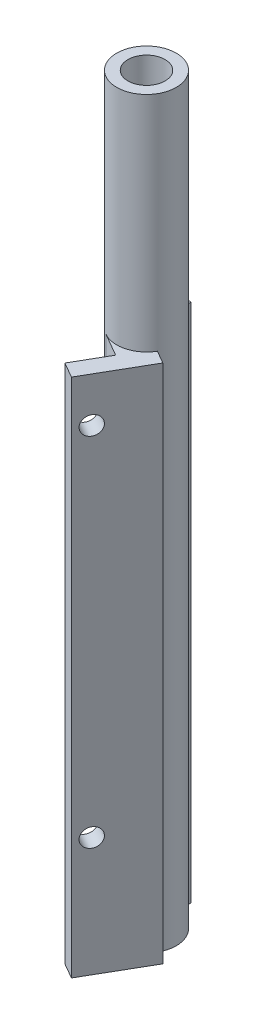
from build123d import *

# Parameters (mm, degrees)
SKETCH1_R           = 5.08
BOSS_EXTRUDE1_DEPTH = 127
SKETCH2_R           = 3.175
CUT_EXTRUDE1_DEPTH  = 128.2030377
BOSS_EXTRUDE2_DEPTH = 88.9
CUT_EXTRUDE2_REACH  = 130.39
SKETCH4_R           = 1.5875
CUT_EXTRUDE6_REACH  = 130.39
SKETCH7_R           = 1.5875
CUT_EXTRUDE7_REACH  = 130.39
SKETCH8_W           = 6.35
SKETCH8_H           = 4.572
SKETCH9_W           = 11.43
SKETCH9_H           = 88.9
CUT_EXTRUDE8_DEPTH  = 2.54
SKETCH10_W          = 11.43
SKETCH10_H          = 88.9
CUT_EXTRUDE9_DEPTH  = 2.54


with BuildPart() as part:
    # Sketch1 → Boss-Extrude1 (new body)
    with BuildSketch(Plane(origin=(0, 0, 0), x_dir=(1, 0, 0), z_dir=(0, 1, 0))):
        Circle(SKETCH1_R)
    extrude(amount=BOSS_EXTRUDE1_DEPTH)

    # Sketch2 → Cut-Extrude1 (cut, through all)
    with BuildSketch(Plane.XZ):
        Circle(SKETCH2_R)
    extrude(amount=-CUT_EXTRUDE1_DEPTH, mode=Mode.SUBTRACT)

    # Sketch3 → Boss-Extrude2 (add)
    with BuildSketch(Plane.XZ):
        with BuildLine():
            Line((-1.315590949, 12.438670365), (-5.715, 9.898670365))
            Line((-5.715, 9.898670365), (-2.54, 4.399409051))
            ThreePointArc((-2.54, 4.399409051), (2.749630657, -1.5875), (-5.08, 0))
            Line((-5.08, 0), (-11.43, 0))
            Line((-11.43, 0), (-11.43, -5.08))
            Line((-11.43, -5.08), (-11.43, -10.16))
            Line((-11.43, -10.16), (0, -10.16))
            Line((0, -10.16), (0, -5.08))
            ThreePointArc((0, -5.08), (4.399409051, -2.54), (4.399409051, 2.54))
            Line((4.399409051, 2.54), (8.798818102, 5.08))
            Line((8.798818102, 5.08), (3.083818102, 14.978670365))
            Line((3.083818102, 14.978670365), (-1.315590949, 12.438670365))
        make_face()
    extrude(amount=-BOSS_EXTRUDE2_DEPTH)

    # Sketch4 → Cut-Extrude2 (cut, up to next)
    with BuildSketch(Plane.XY, mode=Mode.PRIVATE) as cut_extrude2_sk1:
        with Locations((-8.89, 81.28)):
            Circle(SKETCH4_R)
    cut_extrude2_tool1 = extrude(cut_extrude2_sk1.sketch, amount=-CUT_EXTRUDE2_REACH, mode=Mode.PRIVATE) & part.part
    # Sketch4 → Cut-Extrude2 (cut, up to next)
    with BuildSketch(Plane.XY, mode=Mode.PRIVATE) as cut_extrude2_sk2:
        with Locations((-8.89, 20.32)):
            Circle(SKETCH4_R)
    cut_extrude2_tool2 = extrude(cut_extrude2_sk2.sketch, amount=-CUT_EXTRUDE2_REACH, mode=Mode.PRIVATE) & part.part
    add(cut_extrude2_tool1.solids().sort_by_distance((-8.89, 81.28, 0))[0], mode=Mode.SUBTRACT)
    add(cut_extrude2_tool2.solids().sort_by_distance((-8.89, 20.32, 0))[0], mode=Mode.SUBTRACT)

    # Sketch7 → Cut-Extrude6 (cut, up to next)
    with BuildSketch(Plane(origin=(0, 0, 0), x_dir=(0.49999999999999784, 0, -0.86602540378444), z_dir=(0.86602540378444, 0, 0.49999999999999784)), mode=Mode.PRIVATE) as cut_extrude6_sk1:
        with Locations((-8.89, 81.28)):
            Circle(SKETCH7_R)
    cut_extrude6_tool1 = extrude(cut_extrude6_sk1.sketch, amount=CUT_EXTRUDE6_REACH, mode=Mode.PRIVATE) & part.part
    # Sketch7 → Cut-Extrude6 (cut, up to next)
    with BuildSketch(Plane(origin=(0, 0, 0), x_dir=(0.49999999999999784, 0, -0.86602540378444), z_dir=(0.86602540378444, 0, 0.49999999999999784)), mode=Mode.PRIVATE) as cut_extrude6_sk2:
        with Locations((-8.89, 20.32)):
            Circle(SKETCH7_R)
    cut_extrude6_tool2 = extrude(cut_extrude6_sk2.sketch, amount=CUT_EXTRUDE6_REACH, mode=Mode.PRIVATE) & part.part
    add(cut_extrude6_tool1.solids().sort_by_distance((-4.445, 81.28, 7.698966))[0], mode=Mode.SUBTRACT)
    add(cut_extrude6_tool2.solids().sort_by_distance((-4.445, 20.32, 7.698966))[0], mode=Mode.SUBTRACT)

    # Sketch8 → Cut-Extrude7 (cut, up to next)
    with BuildSketch(Plane.XZ, mode=Mode.PRIVATE) as cut_extrude7_sk1:
        Polygon((-5.715, 9.898670365), (-1.755531854, 12.184670365), (1.419468146, 6.685409051), (-2.54, 4.399409051), align=None)
    cut_extrude7_tool1 = extrude(cut_extrude7_sk1.sketch, amount=-CUT_EXTRUDE7_REACH, mode=Mode.PRIVATE) & part.part
    # Sketch8 → Cut-Extrude7 (cut, up to next)
    with BuildSketch(Plane.XZ, mode=Mode.PRIVATE) as cut_extrude7_sk2:
        with Locations((-8.255, -2.286)):
            Rectangle(SKETCH8_W, SKETCH8_H)
    cut_extrude7_tool2 = extrude(cut_extrude7_sk2.sketch, amount=-CUT_EXTRUDE7_REACH, mode=Mode.PRIVATE) & part.part
    add(cut_extrude7_tool1.solids().sort_by_distance((-2.147766, 0, 8.29204))[0], mode=Mode.SUBTRACT)
    add(cut_extrude7_tool2.solids().sort_by_distance((-8.255, 0, -2.286))[0], mode=Mode.SUBTRACT)

    # Sketch9 → Cut-Extrude8 (cut)
    with BuildSketch(Plane(origin=(0, 0, -10.16), x_dir=(-1, 0, 0), z_dir=(0, 0, -1))):
        with Locations((5.715, 44.45)):
            Rectangle(SKETCH9_W, SKETCH9_H)
    extrude(amount=-CUT_EXTRUDE8_DEPTH, mode=Mode.SUBTRACT)

    # Sketch10 → Cut-Extrude9 (cut)
    with BuildSketch(Plane(origin=(8.798818102, 0, 5.08), x_dir=(0.4999999999999982, 0, -0.8660254037844397), z_dir=(0.8660254037844398, 0, 0.4999999999999983))):
        with Locations((-5.715, 44.45)):
            Rectangle(SKETCH10_W, SKETCH10_H)
    extrude(amount=-CUT_EXTRUDE9_DEPTH, mode=Mode.SUBTRACT)


solid = part.part
